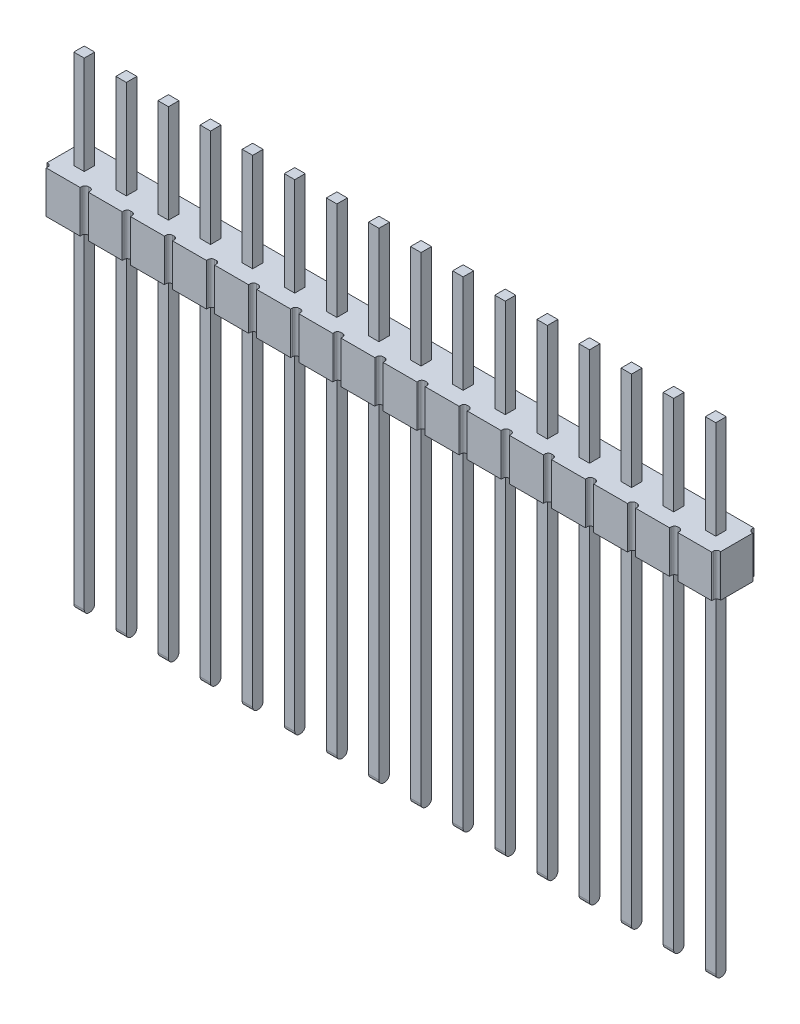
from build123d import *

# Parameters (mm, degrees)
BOSS_EXTRUDE1_DEPTH      = 1.285
BOSS_EXTRUDE1_DEPTH_BACK = 1.285
SKETCH1_W                = 41.12
SKETCH1_H                = 2.57
CUT_EXTRUDE2_DEPTH       = 21.759810332
LPATTERN2_COUNT          = 9
LPATTERN2_PITCH          = 2.57
LPATTERN2_COUNT_DIR2     = 9
LPATTERN2_PITCH_DIR2     = 2.57
MIRROR2_COPY_1_DEPTH     = 21.759810332
MIRROR2_COPY_2_DEPTH     = 21.759810332
MIRROR2_COPY_3_DEPTH     = 21.759810332
MIRROR2_COPY_4_DEPTH     = 21.759810332
MIRROR2_COPY_5_DEPTH     = 21.759810332
MIRROR2_COPY_6_DEPTH     = 21.759810332
MIRROR2_COPY_7_DEPTH     = 21.759810332
MIRROR2_COPY_8_DEPTH     = 21.759810332
MIRROR2_COPY_9_DEPTH     = 21.759810332
MIRROR2_COPY_10_DEPTH    = 21.759810332
MIRROR2_COPY_11_DEPTH    = 21.759810332
MIRROR2_COPY_12_DEPTH    = 21.759810332
MIRROR2_COPY_13_DEPTH    = 21.759810332
MIRROR2_COPY_14_DEPTH    = 21.759810332
MIRROR2_COPY_15_DEPTH    = 21.759810332
MIRROR2_COPY_16_DEPTH    = 21.759810332
MIRROR2_COPY_17_DEPTH    = 21.759810332
MIRROR2_COPY_18_DEPTH    = 21.759810332
MIRROR2_COPY_19_DEPTH    = 21.759810332
MIRROR2_COPY_20_DEPTH    = 21.759810332
MIRROR2_COPY_21_DEPTH    = 21.759810332
MIRROR2_COPY_22_DEPTH    = 21.759810332
MIRROR2_COPY_23_DEPTH    = 21.759810332
MIRROR2_COPY_24_DEPTH    = 21.759810332
MIRROR2_COPY_25_DEPTH    = 21.759810332
MIRROR2_COPY_26_DEPTH    = 21.759810332
MIRROR2_COPY_27_DEPTH    = 21.759810332
MIRROR2_COPY_28_DEPTH    = 21.759810332
MIRROR2_COPY_29_DEPTH    = 21.759810332
MIRROR2_COPY_30_DEPTH    = 21.759810332
MIRROR2_COPY_31_DEPTH    = 21.759810332
MIRROR2_COPY_32_DEPTH    = 21.759810332
MIRROR2_COPY_33_DEPTH    = 21.759810332
MIRROR2_COPY_34_DEPTH    = 21.759810332
MIRROR2_COPY_35_DEPTH    = 21.759810332
MIRROR2_COPY_36_DEPTH    = 21.759810332
MIRROR2_COPY_37_DEPTH    = 21.759810332
MIRROR2_COPY_38_DEPTH    = 21.759810332
MIRROR2_COPY_39_DEPTH    = 21.759810332
MIRROR2_COPY_40_DEPTH    = 21.759810332
MIRROR2_COPY_41_DEPTH    = 21.759810332
MIRROR2_COPY_42_DEPTH    = 21.759810332
MIRROR2_COPY_43_DEPTH    = 21.759810332
MIRROR2_COPY_44_DEPTH    = 21.759810332
MIRROR2_COPY_45_DEPTH    = 21.759810332
MIRROR2_COPY_46_DEPTH    = 21.759810332
MIRROR2_COPY_47_DEPTH    = 21.759810332
MIRROR2_COPY_48_DEPTH    = 21.759810332
MIRROR2_COPY_49_DEPTH    = 21.759810332
MIRROR2_COPY_50_DEPTH    = 21.759810332
MIRROR2_COPY_51_DEPTH    = 21.759810332
MIRROR2_COPY_52_DEPTH    = 21.759810332
MIRROR2_COPY_53_DEPTH    = 21.759810332
MIRROR2_COPY_54_DEPTH    = 21.759810332
MIRROR2_COPY_55_DEPTH    = 21.759810332
MIRROR2_COPY_56_DEPTH    = 21.759810332
MIRROR2_COPY_57_DEPTH    = 21.759810332
MIRROR2_COPY_58_DEPTH    = 21.759810332
MIRROR2_COPY_59_DEPTH    = 21.759810332
MIRROR2_COPY_60_DEPTH    = 21.759810332
MIRROR2_COPY_61_DEPTH    = 21.759810332
MIRROR2_COPY_62_DEPTH    = 21.759810332
MIRROR2_COPY_63_DEPTH    = 21.759810332
MIRROR2_COPY_64_DEPTH    = 21.759810332
MIRROR2_COPY_65_DEPTH    = 21.759810332
MIRROR2_COPY_66_DEPTH    = 21.759810332
MIRROR2_COPY_67_DEPTH    = 21.759810332
MIRROR2_COPY_68_DEPTH    = 21.759810332
MIRROR2_COPY_69_DEPTH    = 21.759810332
MIRROR2_COPY_70_DEPTH    = 21.759810332
MIRROR2_COPY_71_DEPTH    = 21.759810332
MIRROR2_COPY_72_DEPTH    = 21.759810332
MIRROR2_COPY_73_DEPTH    = 21.759810332
MIRROR2_COPY_74_DEPTH    = 21.759810332
MIRROR2_COPY_75_DEPTH    = 21.759810332
MIRROR2_COPY_76_DEPTH    = 21.759810332
MIRROR2_COPY_77_DEPTH    = 21.759810332
MIRROR2_COPY_78_DEPTH    = 21.759810332
MIRROR2_COPY_79_DEPTH    = 21.759810332
MIRROR2_COPY_80_DEPTH    = 21.759810332
MIRROR2_COPY_81_DEPTH    = 21.759810332
SKETCH5_W                = 0.64
SKETCH5_H                = 0.64
BOSS_EXTRUDE2_DEPTH      = 20.9
SKETCH4_W                = 0.64
SKETCH4_H                = 0.64
BOSS_EXTRUDE3_DEPTH      = 6
LPATTERN6_COUNT          = 9
LPATTERN6_PITCH          = 2.57
LPATTERN6_COUNT_DIR2     = 8
LPATTERN6_PITCH_DIR2     = 2.57
FILLET2_R                = 0.3


with BuildPart() as part:
    # Sketch1 → Boss-Extrude1 (new, two sides: drawn at the far end of the back side and taken through both)
    with BuildSketch(Plane.XY.offset(-BOSS_EXTRUDE1_DEPTH_BACK)):
        Rectangle(SKETCH1_W, SKETCH1_H)
    extrude(amount=BOSS_EXTRUDE1_DEPTH + BOSS_EXTRUDE1_DEPTH_BACK)

    # Sketch3 → Cut-Extrude2 (cut, through all)
    with BuildSketch(Plane(origin=(0, 1.285, 0), x_dir=(1, 0, 0), z_dir=(0, 1, 0))):
        with BuildLine():
            Line((-0.05, -0.985), (0.05, -0.985))
            ThreePointArc((0.05, -0.985), (0.191421356, -1.043578644), (0.25, -1.185))
            Line((0.25, -1.185), (0.25, -1.285))
            Line((0.25, -1.285), (-0.25, -1.285))
            Line((-0.25, -1.285), (-0.25, -1.185))
            ThreePointArc((-0.25, -1.185), (-0.191421356, -1.043578644), (-0.05, -0.985))
        make_face()
    cut_extrude2 = extrude(amount=-CUT_EXTRUDE2_DEPTH, mode=Mode.SUBTRACT)

    # LPattern2: Cut-Extrude2 9 × 9
    with Locations(*[Vector(-1, 0, 0) * (i * LPATTERN2_PITCH) + Vector(1, 0, 0) * (j * LPATTERN2_PITCH_DIR2) for i in range(LPATTERN2_COUNT) for j in range(LPATTERN2_COUNT_DIR2) if (i, j) != (0, 0)]):
        add(cut_extrude2, mode=Mode.SUBTRACT)

    # Mirror2 copy 1 sketch → Mirror2 copy 1 (cut, through all)
    with BuildSketch(Plane(origin=(2.57, 1.285, 0), x_dir=(1, 0, 0), z_dir=(0, 1, 0))):
        with BuildLine():
            Line((-0.05, 0.985), (0.05, 0.985))
            ThreePointArc((0.05, 0.985), (0.191421356, 1.043578644), (0.25, 1.185))
            Line((0.25, 1.185), (0.25, 1.285))
            Line((0.25, 1.285), (-0.25, 1.285))
            Line((-0.25, 1.285), (-0.25, 1.185))
            ThreePointArc((-0.25, 1.185), (-0.191421356, 1.043578644), (-0.05, 0.985))
        make_face()
    extrude(amount=-MIRROR2_COPY_1_DEPTH, mode=Mode.SUBTRACT)

    # Mirror2 copy 2 sketch → Mirror2 copy 2 (cut, through all)
    with BuildSketch(Plane(origin=(5.14, 1.285, 0), x_dir=(1, 0, 0), z_dir=(0, 1, 0))):
        with BuildLine():
            Line((-0.05, 0.985), (0.05, 0.985))
            ThreePointArc((0.05, 0.985), (0.191421356, 1.043578644), (0.25, 1.185))
            Line((0.25, 1.185), (0.25, 1.285))
            Line((0.25, 1.285), (-0.25, 1.285))
            Line((-0.25, 1.285), (-0.25, 1.185))
            ThreePointArc((-0.25, 1.185), (-0.191421356, 1.043578644), (-0.05, 0.985))
        make_face()
    extrude(amount=-MIRROR2_COPY_2_DEPTH, mode=Mode.SUBTRACT)

    # Mirror2 copy 3 sketch → Mirror2 copy 3 (cut, through all)
    with BuildSketch(Plane(origin=(7.71, 1.285, 0), x_dir=(1, 0, 0), z_dir=(0, 1, 0))):
        with BuildLine():
            Line((-0.05, 0.985), (0.05, 0.985))
            ThreePointArc((0.05, 0.985), (0.191421356, 1.043578644), (0.25, 1.185))
            Line((0.25, 1.185), (0.25, 1.285))
            Line((0.25, 1.285), (-0.25, 1.285))
            Line((-0.25, 1.285), (-0.25, 1.185))
            ThreePointArc((-0.25, 1.185), (-0.191421356, 1.043578644), (-0.05, 0.985))
        make_face()
    extrude(amount=-MIRROR2_COPY_3_DEPTH, mode=Mode.SUBTRACT)

    # Mirror2 copy 4 sketch → Mirror2 copy 4 (cut, through all)
    with BuildSketch(Plane(origin=(10.28, 1.285, 0), x_dir=(1, 0, 0), z_dir=(0, 1, 0))):
        with BuildLine():
            Line((-0.05, 0.985), (0.05, 0.985))
            ThreePointArc((0.05, 0.985), (0.191421356, 1.043578644), (0.25, 1.185))
            Line((0.25, 1.185), (0.25, 1.285))
            Line((0.25, 1.285), (-0.25, 1.285))
            Line((-0.25, 1.285), (-0.25, 1.185))
            ThreePointArc((-0.25, 1.185), (-0.191421356, 1.043578644), (-0.05, 0.985))
        make_face()
    extrude(amount=-MIRROR2_COPY_4_DEPTH, mode=Mode.SUBTRACT)

    # Mirror2 copy 5 sketch → Mirror2 copy 5 (cut, through all)
    with BuildSketch(Plane(origin=(12.85, 1.285, 0), x_dir=(1, 0, 0), z_dir=(0, 1, 0))):
        with BuildLine():
            Line((-0.05, 0.985), (0.05, 0.985))
            ThreePointArc((0.05, 0.985), (0.191421356, 1.043578644), (0.25, 1.185))
            Line((0.25, 1.185), (0.25, 1.285))
            Line((0.25, 1.285), (-0.25, 1.285))
            Line((-0.25, 1.285), (-0.25, 1.185))
            ThreePointArc((-0.25, 1.185), (-0.191421356, 1.043578644), (-0.05, 0.985))
        make_face()
    extrude(amount=-MIRROR2_COPY_5_DEPTH, mode=Mode.SUBTRACT)

    # Mirror2 copy 6 sketch → Mirror2 copy 6 (cut, through all)
    with BuildSketch(Plane(origin=(15.42, 1.285, 0), x_dir=(1, 0, 0), z_dir=(0, 1, 0))):
        with BuildLine():
            Line((-0.05, 0.985), (0.05, 0.985))
            ThreePointArc((0.05, 0.985), (0.191421356, 1.043578644), (0.25, 1.185))
            Line((0.25, 1.185), (0.25, 1.285))
            Line((0.25, 1.285), (-0.25, 1.285))
            Line((-0.25, 1.285), (-0.25, 1.185))
            ThreePointArc((-0.25, 1.185), (-0.191421356, 1.043578644), (-0.05, 0.985))
        make_face()
    extrude(amount=-MIRROR2_COPY_6_DEPTH, mode=Mode.SUBTRACT)

    # Mirror2 copy 7 sketch → Mirror2 copy 7 (cut, through all)
    with BuildSketch(Plane(origin=(17.99, 1.285, 0), x_dir=(1, 0, 0), z_dir=(0, 1, 0))):
        with BuildLine():
            Line((-0.05, 0.985), (0.05, 0.985))
            ThreePointArc((0.05, 0.985), (0.191421356, 1.043578644), (0.25, 1.185))
            Line((0.25, 1.185), (0.25, 1.285))
            Line((0.25, 1.285), (-0.25, 1.285))
            Line((-0.25, 1.285), (-0.25, 1.185))
            ThreePointArc((-0.25, 1.185), (-0.191421356, 1.043578644), (-0.05, 0.985))
        make_face()
    extrude(amount=-MIRROR2_COPY_7_DEPTH, mode=Mode.SUBTRACT)

    # Mirror2 copy 8 sketch → Mirror2 copy 8 (cut, through all)
    with BuildSketch(Plane(origin=(20.56, 1.285, 0), x_dir=(1, 0, 0), z_dir=(0, 1, 0))):
        with BuildLine():
            Line((-0.05, 0.985), (0.05, 0.985))
            ThreePointArc((0.05, 0.985), (0.191421356, 1.043578644), (0.25, 1.185))
            Line((0.25, 1.185), (0.25, 1.285))
            Line((0.25, 1.285), (-0.25, 1.285))
            Line((-0.25, 1.285), (-0.25, 1.185))
            ThreePointArc((-0.25, 1.185), (-0.191421356, 1.043578644), (-0.05, 0.985))
        make_face()
    extrude(amount=-MIRROR2_COPY_8_DEPTH, mode=Mode.SUBTRACT)

    # Mirror2 copy 9 sketch → Mirror2 copy 9 (cut, through all)
    with BuildSketch(Plane(origin=(-2.57, 1.285, 0), x_dir=(1, 0, 0), z_dir=(0, 1, 0))):
        with BuildLine():
            Line((-0.05, 0.985), (0.05, 0.985))
            ThreePointArc((0.05, 0.985), (0.191421356, 1.043578644), (0.25, 1.185))
            Line((0.25, 1.185), (0.25, 1.285))
            Line((0.25, 1.285), (-0.25, 1.285))
            Line((-0.25, 1.285), (-0.25, 1.185))
            ThreePointArc((-0.25, 1.185), (-0.191421356, 1.043578644), (-0.05, 0.985))
        make_face()
    extrude(amount=-MIRROR2_COPY_9_DEPTH, mode=Mode.SUBTRACT)

    # Mirror2 copy 10 sketch → Mirror2 copy 10 (cut, through all)
    with BuildSketch(Plane(origin=(0, 1.285, 0), x_dir=(1, 0, 0), z_dir=(0, 1, 0))):
        with BuildLine():
            Line((-0.05, 0.985), (0.05, 0.985))
            ThreePointArc((0.05, 0.985), (0.191421356, 1.043578644), (0.25, 1.185))
            Line((0.25, 1.185), (0.25, 1.285))
            Line((0.25, 1.285), (-0.25, 1.285))
            Line((-0.25, 1.285), (-0.25, 1.185))
            ThreePointArc((-0.25, 1.185), (-0.191421356, 1.043578644), (-0.05, 0.985))
        make_face()
    extrude(amount=-MIRROR2_COPY_10_DEPTH, mode=Mode.SUBTRACT)

    # Mirror2 copy 11 sketch → Mirror2 copy 11 (cut, through all)
    with BuildSketch(Plane(origin=(2.57, 1.285, 0), x_dir=(1, 0, 0), z_dir=(0, 1, 0))):
        with BuildLine():
            Line((-0.05, 0.985), (0.05, 0.985))
            ThreePointArc((0.05, 0.985), (0.191421356, 1.043578644), (0.25, 1.185))
            Line((0.25, 1.185), (0.25, 1.285))
            Line((0.25, 1.285), (-0.25, 1.285))
            Line((-0.25, 1.285), (-0.25, 1.185))
            ThreePointArc((-0.25, 1.185), (-0.191421356, 1.043578644), (-0.05, 0.985))
        make_face()
    extrude(amount=-MIRROR2_COPY_11_DEPTH, mode=Mode.SUBTRACT)

    # Mirror2 copy 12 sketch → Mirror2 copy 12 (cut, through all)
    with BuildSketch(Plane(origin=(5.14, 1.285, 0), x_dir=(1, 0, 0), z_dir=(0, 1, 0))):
        with BuildLine():
            Line((-0.05, 0.985), (0.05, 0.985))
            ThreePointArc((0.05, 0.985), (0.191421356, 1.043578644), (0.25, 1.185))
            Line((0.25, 1.185), (0.25, 1.285))
            Line((0.25, 1.285), (-0.25, 1.285))
            Line((-0.25, 1.285), (-0.25, 1.185))
            ThreePointArc((-0.25, 1.185), (-0.191421356, 1.043578644), (-0.05, 0.985))
        make_face()
    extrude(amount=-MIRROR2_COPY_12_DEPTH, mode=Mode.SUBTRACT)

    # Mirror2 copy 13 sketch → Mirror2 copy 13 (cut, through all)
    with BuildSketch(Plane(origin=(7.71, 1.285, 0), x_dir=(1, 0, 0), z_dir=(0, 1, 0))):
        with BuildLine():
            Line((-0.05, 0.985), (0.05, 0.985))
            ThreePointArc((0.05, 0.985), (0.191421356, 1.043578644), (0.25, 1.185))
            Line((0.25, 1.185), (0.25, 1.285))
            Line((0.25, 1.285), (-0.25, 1.285))
            Line((-0.25, 1.285), (-0.25, 1.185))
            ThreePointArc((-0.25, 1.185), (-0.191421356, 1.043578644), (-0.05, 0.985))
        make_face()
    extrude(amount=-MIRROR2_COPY_13_DEPTH, mode=Mode.SUBTRACT)

    # Mirror2 copy 14 sketch → Mirror2 copy 14 (cut, through all)
    with BuildSketch(Plane(origin=(10.28, 1.285, 0), x_dir=(1, 0, 0), z_dir=(0, 1, 0))):
        with BuildLine():
            Line((-0.05, 0.985), (0.05, 0.985))
            ThreePointArc((0.05, 0.985), (0.191421356, 1.043578644), (0.25, 1.185))
            Line((0.25, 1.185), (0.25, 1.285))
            Line((0.25, 1.285), (-0.25, 1.285))
            Line((-0.25, 1.285), (-0.25, 1.185))
            ThreePointArc((-0.25, 1.185), (-0.191421356, 1.043578644), (-0.05, 0.985))
        make_face()
    extrude(amount=-MIRROR2_COPY_14_DEPTH, mode=Mode.SUBTRACT)

    # Mirror2 copy 15 sketch → Mirror2 copy 15 (cut, through all)
    with BuildSketch(Plane(origin=(12.85, 1.285, 0), x_dir=(1, 0, 0), z_dir=(0, 1, 0))):
        with BuildLine():
            Line((-0.05, 0.985), (0.05, 0.985))
            ThreePointArc((0.05, 0.985), (0.191421356, 1.043578644), (0.25, 1.185))
            Line((0.25, 1.185), (0.25, 1.285))
            Line((0.25, 1.285), (-0.25, 1.285))
            Line((-0.25, 1.285), (-0.25, 1.185))
            ThreePointArc((-0.25, 1.185), (-0.191421356, 1.043578644), (-0.05, 0.985))
        make_face()
    extrude(amount=-MIRROR2_COPY_15_DEPTH, mode=Mode.SUBTRACT)

    # Mirror2 copy 16 sketch → Mirror2 copy 16 (cut, through all)
    with BuildSketch(Plane(origin=(15.42, 1.285, 0), x_dir=(1, 0, 0), z_dir=(0, 1, 0))):
        with BuildLine():
            Line((-0.05, 0.985), (0.05, 0.985))
            ThreePointArc((0.05, 0.985), (0.191421356, 1.043578644), (0.25, 1.185))
            Line((0.25, 1.185), (0.25, 1.285))
            Line((0.25, 1.285), (-0.25, 1.285))
            Line((-0.25, 1.285), (-0.25, 1.185))
            ThreePointArc((-0.25, 1.185), (-0.191421356, 1.043578644), (-0.05, 0.985))
        make_face()
    extrude(amount=-MIRROR2_COPY_16_DEPTH, mode=Mode.SUBTRACT)

    # Mirror2 copy 17 sketch → Mirror2 copy 17 (cut, through all)
    with BuildSketch(Plane(origin=(17.99, 1.285, 0), x_dir=(1, 0, 0), z_dir=(0, 1, 0))):
        with BuildLine():
            Line((-0.05, 0.985), (0.05, 0.985))
            ThreePointArc((0.05, 0.985), (0.191421356, 1.043578644), (0.25, 1.185))
            Line((0.25, 1.185), (0.25, 1.285))
            Line((0.25, 1.285), (-0.25, 1.285))
            Line((-0.25, 1.285), (-0.25, 1.185))
            ThreePointArc((-0.25, 1.185), (-0.191421356, 1.043578644), (-0.05, 0.985))
        make_face()
    extrude(amount=-MIRROR2_COPY_17_DEPTH, mode=Mode.SUBTRACT)

    # Mirror2 copy 18 sketch → Mirror2 copy 18 (cut, through all)
    with BuildSketch(Plane(origin=(-5.14, 1.285, 0), x_dir=(1, 0, 0), z_dir=(0, 1, 0))):
        with BuildLine():
            Line((-0.05, 0.985), (0.05, 0.985))
            ThreePointArc((0.05, 0.985), (0.191421356, 1.043578644), (0.25, 1.185))
            Line((0.25, 1.185), (0.25, 1.285))
            Line((0.25, 1.285), (-0.25, 1.285))
            Line((-0.25, 1.285), (-0.25, 1.185))
            ThreePointArc((-0.25, 1.185), (-0.191421356, 1.043578644), (-0.05, 0.985))
        make_face()
    extrude(amount=-MIRROR2_COPY_18_DEPTH, mode=Mode.SUBTRACT)

    # Mirror2 copy 19 sketch → Mirror2 copy 19 (cut, through all)
    with BuildSketch(Plane(origin=(-2.57, 1.285, 0), x_dir=(1, 0, 0), z_dir=(0, 1, 0))):
        with BuildLine():
            Line((-0.05, 0.985), (0.05, 0.985))
            ThreePointArc((0.05, 0.985), (0.191421356, 1.043578644), (0.25, 1.185))
            Line((0.25, 1.185), (0.25, 1.285))
            Line((0.25, 1.285), (-0.25, 1.285))
            Line((-0.25, 1.285), (-0.25, 1.185))
            ThreePointArc((-0.25, 1.185), (-0.191421356, 1.043578644), (-0.05, 0.985))
        make_face()
    extrude(amount=-MIRROR2_COPY_19_DEPTH, mode=Mode.SUBTRACT)

    # Mirror2 copy 20 sketch → Mirror2 copy 20 (cut, through all)
    with BuildSketch(Plane(origin=(0, 1.285, 0), x_dir=(1, 0, 0), z_dir=(0, 1, 0))):
        with BuildLine():
            Line((-0.05, 0.985), (0.05, 0.985))
            ThreePointArc((0.05, 0.985), (0.191421356, 1.043578644), (0.25, 1.185))
            Line((0.25, 1.185), (0.25, 1.285))
            Line((0.25, 1.285), (-0.25, 1.285))
            Line((-0.25, 1.285), (-0.25, 1.185))
            ThreePointArc((-0.25, 1.185), (-0.191421356, 1.043578644), (-0.05, 0.985))
        make_face()
    extrude(amount=-MIRROR2_COPY_20_DEPTH, mode=Mode.SUBTRACT)

    # Mirror2 copy 21 sketch → Mirror2 copy 21 (cut, through all)
    with BuildSketch(Plane(origin=(2.57, 1.285, 0), x_dir=(1, 0, 0), z_dir=(0, 1, 0))):
        with BuildLine():
            Line((-0.05, 0.985), (0.05, 0.985))
            ThreePointArc((0.05, 0.985), (0.191421356, 1.043578644), (0.25, 1.185))
            Line((0.25, 1.185), (0.25, 1.285))
            Line((0.25, 1.285), (-0.25, 1.285))
            Line((-0.25, 1.285), (-0.25, 1.185))
            ThreePointArc((-0.25, 1.185), (-0.191421356, 1.043578644), (-0.05, 0.985))
        make_face()
    extrude(amount=-MIRROR2_COPY_21_DEPTH, mode=Mode.SUBTRACT)

    # Mirror2 copy 22 sketch → Mirror2 copy 22 (cut, through all)
    with BuildSketch(Plane(origin=(5.14, 1.285, 0), x_dir=(1, 0, 0), z_dir=(0, 1, 0))):
        with BuildLine():
            Line((-0.05, 0.985), (0.05, 0.985))
            ThreePointArc((0.05, 0.985), (0.191421356, 1.043578644), (0.25, 1.185))
            Line((0.25, 1.185), (0.25, 1.285))
            Line((0.25, 1.285), (-0.25, 1.285))
            Line((-0.25, 1.285), (-0.25, 1.185))
            ThreePointArc((-0.25, 1.185), (-0.191421356, 1.043578644), (-0.05, 0.985))
        make_face()
    extrude(amount=-MIRROR2_COPY_22_DEPTH, mode=Mode.SUBTRACT)

    # Mirror2 copy 23 sketch → Mirror2 copy 23 (cut, through all)
    with BuildSketch(Plane(origin=(7.71, 1.285, 0), x_dir=(1, 0, 0), z_dir=(0, 1, 0))):
        with BuildLine():
            Line((-0.05, 0.985), (0.05, 0.985))
            ThreePointArc((0.05, 0.985), (0.191421356, 1.043578644), (0.25, 1.185))
            Line((0.25, 1.185), (0.25, 1.285))
            Line((0.25, 1.285), (-0.25, 1.285))
            Line((-0.25, 1.285), (-0.25, 1.185))
            ThreePointArc((-0.25, 1.185), (-0.191421356, 1.043578644), (-0.05, 0.985))
        make_face()
    extrude(amount=-MIRROR2_COPY_23_DEPTH, mode=Mode.SUBTRACT)

    # Mirror2 copy 24 sketch → Mirror2 copy 24 (cut, through all)
    with BuildSketch(Plane(origin=(10.28, 1.285, 0), x_dir=(1, 0, 0), z_dir=(0, 1, 0))):
        with BuildLine():
            Line((-0.05, 0.985), (0.05, 0.985))
            ThreePointArc((0.05, 0.985), (0.191421356, 1.043578644), (0.25, 1.185))
            Line((0.25, 1.185), (0.25, 1.285))
            Line((0.25, 1.285), (-0.25, 1.285))
            Line((-0.25, 1.285), (-0.25, 1.185))
            ThreePointArc((-0.25, 1.185), (-0.191421356, 1.043578644), (-0.05, 0.985))
        make_face()
    extrude(amount=-MIRROR2_COPY_24_DEPTH, mode=Mode.SUBTRACT)

    # Mirror2 copy 25 sketch → Mirror2 copy 25 (cut, through all)
    with BuildSketch(Plane(origin=(12.85, 1.285, 0), x_dir=(1, 0, 0), z_dir=(0, 1, 0))):
        with BuildLine():
            Line((-0.05, 0.985), (0.05, 0.985))
            ThreePointArc((0.05, 0.985), (0.191421356, 1.043578644), (0.25, 1.185))
            Line((0.25, 1.185), (0.25, 1.285))
            Line((0.25, 1.285), (-0.25, 1.285))
            Line((-0.25, 1.285), (-0.25, 1.185))
            ThreePointArc((-0.25, 1.185), (-0.191421356, 1.043578644), (-0.05, 0.985))
        make_face()
    extrude(amount=-MIRROR2_COPY_25_DEPTH, mode=Mode.SUBTRACT)

    # Mirror2 copy 26 sketch → Mirror2 copy 26 (cut, through all)
    with BuildSketch(Plane(origin=(15.42, 1.285, 0), x_dir=(1, 0, 0), z_dir=(0, 1, 0))):
        with BuildLine():
            Line((-0.05, 0.985), (0.05, 0.985))
            ThreePointArc((0.05, 0.985), (0.191421356, 1.043578644), (0.25, 1.185))
            Line((0.25, 1.185), (0.25, 1.285))
            Line((0.25, 1.285), (-0.25, 1.285))
            Line((-0.25, 1.285), (-0.25, 1.185))
            ThreePointArc((-0.25, 1.185), (-0.191421356, 1.043578644), (-0.05, 0.985))
        make_face()
    extrude(amount=-MIRROR2_COPY_26_DEPTH, mode=Mode.SUBTRACT)

    # Mirror2 copy 27 sketch → Mirror2 copy 27 (cut, through all)
    with BuildSketch(Plane(origin=(-7.71, 1.285, 0), x_dir=(1, 0, 0), z_dir=(0, 1, 0))):
        with BuildLine():
            Line((-0.05, 0.985), (0.05, 0.985))
            ThreePointArc((0.05, 0.985), (0.191421356, 1.043578644), (0.25, 1.185))
            Line((0.25, 1.185), (0.25, 1.285))
            Line((0.25, 1.285), (-0.25, 1.285))
            Line((-0.25, 1.285), (-0.25, 1.185))
            ThreePointArc((-0.25, 1.185), (-0.191421356, 1.043578644), (-0.05, 0.985))
        make_face()
    extrude(amount=-MIRROR2_COPY_27_DEPTH, mode=Mode.SUBTRACT)

    # Mirror2 copy 28 sketch → Mirror2 copy 28 (cut, through all)
    with BuildSketch(Plane(origin=(-5.14, 1.285, 0), x_dir=(1, 0, 0), z_dir=(0, 1, 0))):
        with BuildLine():
            Line((-0.05, 0.985), (0.05, 0.985))
            ThreePointArc((0.05, 0.985), (0.191421356, 1.043578644), (0.25, 1.185))
            Line((0.25, 1.185), (0.25, 1.285))
            Line((0.25, 1.285), (-0.25, 1.285))
            Line((-0.25, 1.285), (-0.25, 1.185))
            ThreePointArc((-0.25, 1.185), (-0.191421356, 1.043578644), (-0.05, 0.985))
        make_face()
    extrude(amount=-MIRROR2_COPY_28_DEPTH, mode=Mode.SUBTRACT)

    # Mirror2 copy 29 sketch → Mirror2 copy 29 (cut, through all)
    with BuildSketch(Plane(origin=(-2.57, 1.285, 0), x_dir=(1, 0, 0), z_dir=(0, 1, 0))):
        with BuildLine():
            Line((-0.05, 0.985), (0.05, 0.985))
            ThreePointArc((0.05, 0.985), (0.191421356, 1.043578644), (0.25, 1.185))
            Line((0.25, 1.185), (0.25, 1.285))
            Line((0.25, 1.285), (-0.25, 1.285))
            Line((-0.25, 1.285), (-0.25, 1.185))
            ThreePointArc((-0.25, 1.185), (-0.191421356, 1.043578644), (-0.05, 0.985))
        make_face()
    extrude(amount=-MIRROR2_COPY_29_DEPTH, mode=Mode.SUBTRACT)

    # Mirror2 copy 30 sketch → Mirror2 copy 30 (cut, through all)
    with BuildSketch(Plane(origin=(0, 1.285, 0), x_dir=(1, 0, 0), z_dir=(0, 1, 0))):
        with BuildLine():
            Line((-0.05, 0.985), (0.05, 0.985))
            ThreePointArc((0.05, 0.985), (0.191421356, 1.043578644), (0.25, 1.185))
            Line((0.25, 1.185), (0.25, 1.285))
            Line((0.25, 1.285), (-0.25, 1.285))
            Line((-0.25, 1.285), (-0.25, 1.185))
            ThreePointArc((-0.25, 1.185), (-0.191421356, 1.043578644), (-0.05, 0.985))
        make_face()
    extrude(amount=-MIRROR2_COPY_30_DEPTH, mode=Mode.SUBTRACT)

    # Mirror2 copy 31 sketch → Mirror2 copy 31 (cut, through all)
    with BuildSketch(Plane(origin=(2.57, 1.285, 0), x_dir=(1, 0, 0), z_dir=(0, 1, 0))):
        with BuildLine():
            Line((-0.05, 0.985), (0.05, 0.985))
            ThreePointArc((0.05, 0.985), (0.191421356, 1.043578644), (0.25, 1.185))
            Line((0.25, 1.185), (0.25, 1.285))
            Line((0.25, 1.285), (-0.25, 1.285))
            Line((-0.25, 1.285), (-0.25, 1.185))
            ThreePointArc((-0.25, 1.185), (-0.191421356, 1.043578644), (-0.05, 0.985))
        make_face()
    extrude(amount=-MIRROR2_COPY_31_DEPTH, mode=Mode.SUBTRACT)

    # Mirror2 copy 32 sketch → Mirror2 copy 32 (cut, through all)
    with BuildSketch(Plane(origin=(5.14, 1.285, 0), x_dir=(1, 0, 0), z_dir=(0, 1, 0))):
        with BuildLine():
            Line((-0.05, 0.985), (0.05, 0.985))
            ThreePointArc((0.05, 0.985), (0.191421356, 1.043578644), (0.25, 1.185))
            Line((0.25, 1.185), (0.25, 1.285))
            Line((0.25, 1.285), (-0.25, 1.285))
            Line((-0.25, 1.285), (-0.25, 1.185))
            ThreePointArc((-0.25, 1.185), (-0.191421356, 1.043578644), (-0.05, 0.985))
        make_face()
    extrude(amount=-MIRROR2_COPY_32_DEPTH, mode=Mode.SUBTRACT)

    # Mirror2 copy 33 sketch → Mirror2 copy 33 (cut, through all)
    with BuildSketch(Plane(origin=(7.71, 1.285, 0), x_dir=(1, 0, 0), z_dir=(0, 1, 0))):
        with BuildLine():
            Line((-0.05, 0.985), (0.05, 0.985))
            ThreePointArc((0.05, 0.985), (0.191421356, 1.043578644), (0.25, 1.185))
            Line((0.25, 1.185), (0.25, 1.285))
            Line((0.25, 1.285), (-0.25, 1.285))
            Line((-0.25, 1.285), (-0.25, 1.185))
            ThreePointArc((-0.25, 1.185), (-0.191421356, 1.043578644), (-0.05, 0.985))
        make_face()
    extrude(amount=-MIRROR2_COPY_33_DEPTH, mode=Mode.SUBTRACT)

    # Mirror2 copy 34 sketch → Mirror2 copy 34 (cut, through all)
    with BuildSketch(Plane(origin=(10.28, 1.285, 0), x_dir=(1, 0, 0), z_dir=(0, 1, 0))):
        with BuildLine():
            Line((-0.05, 0.985), (0.05, 0.985))
            ThreePointArc((0.05, 0.985), (0.191421356, 1.043578644), (0.25, 1.185))
            Line((0.25, 1.185), (0.25, 1.285))
            Line((0.25, 1.285), (-0.25, 1.285))
            Line((-0.25, 1.285), (-0.25, 1.185))
            ThreePointArc((-0.25, 1.185), (-0.191421356, 1.043578644), (-0.05, 0.985))
        make_face()
    extrude(amount=-MIRROR2_COPY_34_DEPTH, mode=Mode.SUBTRACT)

    # Mirror2 copy 35 sketch → Mirror2 copy 35 (cut, through all)
    with BuildSketch(Plane(origin=(12.85, 1.285, 0), x_dir=(1, 0, 0), z_dir=(0, 1, 0))):
        with BuildLine():
            Line((-0.05, 0.985), (0.05, 0.985))
            ThreePointArc((0.05, 0.985), (0.191421356, 1.043578644), (0.25, 1.185))
            Line((0.25, 1.185), (0.25, 1.285))
            Line((0.25, 1.285), (-0.25, 1.285))
            Line((-0.25, 1.285), (-0.25, 1.185))
            ThreePointArc((-0.25, 1.185), (-0.191421356, 1.043578644), (-0.05, 0.985))
        make_face()
    extrude(amount=-MIRROR2_COPY_35_DEPTH, mode=Mode.SUBTRACT)

    # Mirror2 copy 36 sketch → Mirror2 copy 36 (cut, through all)
    with BuildSketch(Plane(origin=(-10.28, 1.285, 0), x_dir=(1, 0, 0), z_dir=(0, 1, 0))):
        with BuildLine():
            Line((-0.05, 0.985), (0.05, 0.985))
            ThreePointArc((0.05, 0.985), (0.191421356, 1.043578644), (0.25, 1.185))
            Line((0.25, 1.185), (0.25, 1.285))
            Line((0.25, 1.285), (-0.25, 1.285))
            Line((-0.25, 1.285), (-0.25, 1.185))
            ThreePointArc((-0.25, 1.185), (-0.191421356, 1.043578644), (-0.05, 0.985))
        make_face()
    extrude(amount=-MIRROR2_COPY_36_DEPTH, mode=Mode.SUBTRACT)

    # Mirror2 copy 37 sketch → Mirror2 copy 37 (cut, through all)
    with BuildSketch(Plane(origin=(-7.71, 1.285, 0), x_dir=(1, 0, 0), z_dir=(0, 1, 0))):
        with BuildLine():
            Line((-0.05, 0.985), (0.05, 0.985))
            ThreePointArc((0.05, 0.985), (0.191421356, 1.043578644), (0.25, 1.185))
            Line((0.25, 1.185), (0.25, 1.285))
            Line((0.25, 1.285), (-0.25, 1.285))
            Line((-0.25, 1.285), (-0.25, 1.185))
            ThreePointArc((-0.25, 1.185), (-0.191421356, 1.043578644), (-0.05, 0.985))
        make_face()
    extrude(amount=-MIRROR2_COPY_37_DEPTH, mode=Mode.SUBTRACT)

    # Mirror2 copy 38 sketch → Mirror2 copy 38 (cut, through all)
    with BuildSketch(Plane(origin=(-5.14, 1.285, 0), x_dir=(1, 0, 0), z_dir=(0, 1, 0))):
        with BuildLine():
            Line((-0.05, 0.985), (0.05, 0.985))
            ThreePointArc((0.05, 0.985), (0.191421356, 1.043578644), (0.25, 1.185))
            Line((0.25, 1.185), (0.25, 1.285))
            Line((0.25, 1.285), (-0.25, 1.285))
            Line((-0.25, 1.285), (-0.25, 1.185))
            ThreePointArc((-0.25, 1.185), (-0.191421356, 1.043578644), (-0.05, 0.985))
        make_face()
    extrude(amount=-MIRROR2_COPY_38_DEPTH, mode=Mode.SUBTRACT)

    # Mirror2 copy 39 sketch → Mirror2 copy 39 (cut, through all)
    with BuildSketch(Plane(origin=(-2.57, 1.285, 0), x_dir=(1, 0, 0), z_dir=(0, 1, 0))):
        with BuildLine():
            Line((-0.05, 0.985), (0.05, 0.985))
            ThreePointArc((0.05, 0.985), (0.191421356, 1.043578644), (0.25, 1.185))
            Line((0.25, 1.185), (0.25, 1.285))
            Line((0.25, 1.285), (-0.25, 1.285))
            Line((-0.25, 1.285), (-0.25, 1.185))
            ThreePointArc((-0.25, 1.185), (-0.191421356, 1.043578644), (-0.05, 0.985))
        make_face()
    extrude(amount=-MIRROR2_COPY_39_DEPTH, mode=Mode.SUBTRACT)

    # Mirror2 copy 40 sketch → Mirror2 copy 40 (cut, through all)
    with BuildSketch(Plane(origin=(0, 1.285, 0), x_dir=(1, 0, 0), z_dir=(0, 1, 0))):
        with BuildLine():
            Line((-0.05, 0.985), (0.05, 0.985))
            ThreePointArc((0.05, 0.985), (0.191421356, 1.043578644), (0.25, 1.185))
            Line((0.25, 1.185), (0.25, 1.285))
            Line((0.25, 1.285), (-0.25, 1.285))
            Line((-0.25, 1.285), (-0.25, 1.185))
            ThreePointArc((-0.25, 1.185), (-0.191421356, 1.043578644), (-0.05, 0.985))
        make_face()
    extrude(amount=-MIRROR2_COPY_40_DEPTH, mode=Mode.SUBTRACT)

    # Mirror2 copy 41 sketch → Mirror2 copy 41 (cut, through all)
    with BuildSketch(Plane(origin=(2.57, 1.285, 0), x_dir=(1, 0, 0), z_dir=(0, 1, 0))):
        with BuildLine():
            Line((-0.05, 0.985), (0.05, 0.985))
            ThreePointArc((0.05, 0.985), (0.191421356, 1.043578644), (0.25, 1.185))
            Line((0.25, 1.185), (0.25, 1.285))
            Line((0.25, 1.285), (-0.25, 1.285))
            Line((-0.25, 1.285), (-0.25, 1.185))
            ThreePointArc((-0.25, 1.185), (-0.191421356, 1.043578644), (-0.05, 0.985))
        make_face()
    extrude(amount=-MIRROR2_COPY_41_DEPTH, mode=Mode.SUBTRACT)

    # Mirror2 copy 42 sketch → Mirror2 copy 42 (cut, through all)
    with BuildSketch(Plane(origin=(5.14, 1.285, 0), x_dir=(1, 0, 0), z_dir=(0, 1, 0))):
        with BuildLine():
            Line((-0.05, 0.985), (0.05, 0.985))
            ThreePointArc((0.05, 0.985), (0.191421356, 1.043578644), (0.25, 1.185))
            Line((0.25, 1.185), (0.25, 1.285))
            Line((0.25, 1.285), (-0.25, 1.285))
            Line((-0.25, 1.285), (-0.25, 1.185))
            ThreePointArc((-0.25, 1.185), (-0.191421356, 1.043578644), (-0.05, 0.985))
        make_face()
    extrude(amount=-MIRROR2_COPY_42_DEPTH, mode=Mode.SUBTRACT)

    # Mirror2 copy 43 sketch → Mirror2 copy 43 (cut, through all)
    with BuildSketch(Plane(origin=(7.71, 1.285, 0), x_dir=(1, 0, 0), z_dir=(0, 1, 0))):
        with BuildLine():
            Line((-0.05, 0.985), (0.05, 0.985))
            ThreePointArc((0.05, 0.985), (0.191421356, 1.043578644), (0.25, 1.185))
            Line((0.25, 1.185), (0.25, 1.285))
            Line((0.25, 1.285), (-0.25, 1.285))
            Line((-0.25, 1.285), (-0.25, 1.185))
            ThreePointArc((-0.25, 1.185), (-0.191421356, 1.043578644), (-0.05, 0.985))
        make_face()
    extrude(amount=-MIRROR2_COPY_43_DEPTH, mode=Mode.SUBTRACT)

    # Mirror2 copy 44 sketch → Mirror2 copy 44 (cut, through all)
    with BuildSketch(Plane(origin=(10.28, 1.285, 0), x_dir=(1, 0, 0), z_dir=(0, 1, 0))):
        with BuildLine():
            Line((-0.05, 0.985), (0.05, 0.985))
            ThreePointArc((0.05, 0.985), (0.191421356, 1.043578644), (0.25, 1.185))
            Line((0.25, 1.185), (0.25, 1.285))
            Line((0.25, 1.285), (-0.25, 1.285))
            Line((-0.25, 1.285), (-0.25, 1.185))
            ThreePointArc((-0.25, 1.185), (-0.191421356, 1.043578644), (-0.05, 0.985))
        make_face()
    extrude(amount=-MIRROR2_COPY_44_DEPTH, mode=Mode.SUBTRACT)

    # Mirror2 copy 45 sketch → Mirror2 copy 45 (cut, through all)
    with BuildSketch(Plane(origin=(-12.85, 1.285, 0), x_dir=(1, 0, 0), z_dir=(0, 1, 0))):
        with BuildLine():
            Line((-0.05, 0.985), (0.05, 0.985))
            ThreePointArc((0.05, 0.985), (0.191421356, 1.043578644), (0.25, 1.185))
            Line((0.25, 1.185), (0.25, 1.285))
            Line((0.25, 1.285), (-0.25, 1.285))
            Line((-0.25, 1.285), (-0.25, 1.185))
            ThreePointArc((-0.25, 1.185), (-0.191421356, 1.043578644), (-0.05, 0.985))
        make_face()
    extrude(amount=-MIRROR2_COPY_45_DEPTH, mode=Mode.SUBTRACT)

    # Mirror2 copy 46 sketch → Mirror2 copy 46 (cut, through all)
    with BuildSketch(Plane(origin=(-10.28, 1.285, 0), x_dir=(1, 0, 0), z_dir=(0, 1, 0))):
        with BuildLine():
            Line((-0.05, 0.985), (0.05, 0.985))
            ThreePointArc((0.05, 0.985), (0.191421356, 1.043578644), (0.25, 1.185))
            Line((0.25, 1.185), (0.25, 1.285))
            Line((0.25, 1.285), (-0.25, 1.285))
            Line((-0.25, 1.285), (-0.25, 1.185))
            ThreePointArc((-0.25, 1.185), (-0.191421356, 1.043578644), (-0.05, 0.985))
        make_face()
    extrude(amount=-MIRROR2_COPY_46_DEPTH, mode=Mode.SUBTRACT)

    # Mirror2 copy 47 sketch → Mirror2 copy 47 (cut, through all)
    with BuildSketch(Plane(origin=(-7.71, 1.285, 0), x_dir=(1, 0, 0), z_dir=(0, 1, 0))):
        with BuildLine():
            Line((-0.05, 0.985), (0.05, 0.985))
            ThreePointArc((0.05, 0.985), (0.191421356, 1.043578644), (0.25, 1.185))
            Line((0.25, 1.185), (0.25, 1.285))
            Line((0.25, 1.285), (-0.25, 1.285))
            Line((-0.25, 1.285), (-0.25, 1.185))
            ThreePointArc((-0.25, 1.185), (-0.191421356, 1.043578644), (-0.05, 0.985))
        make_face()
    extrude(amount=-MIRROR2_COPY_47_DEPTH, mode=Mode.SUBTRACT)

    # Mirror2 copy 48 sketch → Mirror2 copy 48 (cut, through all)
    with BuildSketch(Plane(origin=(-5.14, 1.285, 0), x_dir=(1, 0, 0), z_dir=(0, 1, 0))):
        with BuildLine():
            Line((-0.05, 0.985), (0.05, 0.985))
            ThreePointArc((0.05, 0.985), (0.191421356, 1.043578644), (0.25, 1.185))
            Line((0.25, 1.185), (0.25, 1.285))
            Line((0.25, 1.285), (-0.25, 1.285))
            Line((-0.25, 1.285), (-0.25, 1.185))
            ThreePointArc((-0.25, 1.185), (-0.191421356, 1.043578644), (-0.05, 0.985))
        make_face()
    extrude(amount=-MIRROR2_COPY_48_DEPTH, mode=Mode.SUBTRACT)

    # Mirror2 copy 49 sketch → Mirror2 copy 49 (cut, through all)
    with BuildSketch(Plane(origin=(-2.57, 1.285, 0), x_dir=(1, 0, 0), z_dir=(0, 1, 0))):
        with BuildLine():
            Line((-0.05, 0.985), (0.05, 0.985))
            ThreePointArc((0.05, 0.985), (0.191421356, 1.043578644), (0.25, 1.185))
            Line((0.25, 1.185), (0.25, 1.285))
            Line((0.25, 1.285), (-0.25, 1.285))
            Line((-0.25, 1.285), (-0.25, 1.185))
            ThreePointArc((-0.25, 1.185), (-0.191421356, 1.043578644), (-0.05, 0.985))
        make_face()
    extrude(amount=-MIRROR2_COPY_49_DEPTH, mode=Mode.SUBTRACT)

    # Mirror2 copy 50 sketch → Mirror2 copy 50 (cut, through all)
    with BuildSketch(Plane(origin=(0, 1.285, 0), x_dir=(1, 0, 0), z_dir=(0, 1, 0))):
        with BuildLine():
            Line((-0.05, 0.985), (0.05, 0.985))
            ThreePointArc((0.05, 0.985), (0.191421356, 1.043578644), (0.25, 1.185))
            Line((0.25, 1.185), (0.25, 1.285))
            Line((0.25, 1.285), (-0.25, 1.285))
            Line((-0.25, 1.285), (-0.25, 1.185))
            ThreePointArc((-0.25, 1.185), (-0.191421356, 1.043578644), (-0.05, 0.985))
        make_face()
    extrude(amount=-MIRROR2_COPY_50_DEPTH, mode=Mode.SUBTRACT)

    # Mirror2 copy 51 sketch → Mirror2 copy 51 (cut, through all)
    with BuildSketch(Plane(origin=(2.57, 1.285, 0), x_dir=(1, 0, 0), z_dir=(0, 1, 0))):
        with BuildLine():
            Line((-0.05, 0.985), (0.05, 0.985))
            ThreePointArc((0.05, 0.985), (0.191421356, 1.043578644), (0.25, 1.185))
            Line((0.25, 1.185), (0.25, 1.285))
            Line((0.25, 1.285), (-0.25, 1.285))
            Line((-0.25, 1.285), (-0.25, 1.185))
            ThreePointArc((-0.25, 1.185), (-0.191421356, 1.043578644), (-0.05, 0.985))
        make_face()
    extrude(amount=-MIRROR2_COPY_51_DEPTH, mode=Mode.SUBTRACT)

    # Mirror2 copy 52 sketch → Mirror2 copy 52 (cut, through all)
    with BuildSketch(Plane(origin=(5.14, 1.285, 0), x_dir=(1, 0, 0), z_dir=(0, 1, 0))):
        with BuildLine():
            Line((-0.05, 0.985), (0.05, 0.985))
            ThreePointArc((0.05, 0.985), (0.191421356, 1.043578644), (0.25, 1.185))
            Line((0.25, 1.185), (0.25, 1.285))
            Line((0.25, 1.285), (-0.25, 1.285))
            Line((-0.25, 1.285), (-0.25, 1.185))
            ThreePointArc((-0.25, 1.185), (-0.191421356, 1.043578644), (-0.05, 0.985))
        make_face()
    extrude(amount=-MIRROR2_COPY_52_DEPTH, mode=Mode.SUBTRACT)

    # Mirror2 copy 53 sketch → Mirror2 copy 53 (cut, through all)
    with BuildSketch(Plane(origin=(7.71, 1.285, 0), x_dir=(1, 0, 0), z_dir=(0, 1, 0))):
        with BuildLine():
            Line((-0.05, 0.985), (0.05, 0.985))
            ThreePointArc((0.05, 0.985), (0.191421356, 1.043578644), (0.25, 1.185))
            Line((0.25, 1.185), (0.25, 1.285))
            Line((0.25, 1.285), (-0.25, 1.285))
            Line((-0.25, 1.285), (-0.25, 1.185))
            ThreePointArc((-0.25, 1.185), (-0.191421356, 1.043578644), (-0.05, 0.985))
        make_face()
    extrude(amount=-MIRROR2_COPY_53_DEPTH, mode=Mode.SUBTRACT)

    # Mirror2 copy 54 sketch → Mirror2 copy 54 (cut, through all)
    with BuildSketch(Plane(origin=(-15.42, 1.285, 0), x_dir=(1, 0, 0), z_dir=(0, 1, 0))):
        with BuildLine():
            Line((-0.05, 0.985), (0.05, 0.985))
            ThreePointArc((0.05, 0.985), (0.191421356, 1.043578644), (0.25, 1.185))
            Line((0.25, 1.185), (0.25, 1.285))
            Line((0.25, 1.285), (-0.25, 1.285))
            Line((-0.25, 1.285), (-0.25, 1.185))
            ThreePointArc((-0.25, 1.185), (-0.191421356, 1.043578644), (-0.05, 0.985))
        make_face()
    extrude(amount=-MIRROR2_COPY_54_DEPTH, mode=Mode.SUBTRACT)

    # Mirror2 copy 55 sketch → Mirror2 copy 55 (cut, through all)
    with BuildSketch(Plane(origin=(-12.85, 1.285, 0), x_dir=(1, 0, 0), z_dir=(0, 1, 0))):
        with BuildLine():
            Line((-0.05, 0.985), (0.05, 0.985))
            ThreePointArc((0.05, 0.985), (0.191421356, 1.043578644), (0.25, 1.185))
            Line((0.25, 1.185), (0.25, 1.285))
            Line((0.25, 1.285), (-0.25, 1.285))
            Line((-0.25, 1.285), (-0.25, 1.185))
            ThreePointArc((-0.25, 1.185), (-0.191421356, 1.043578644), (-0.05, 0.985))
        make_face()
    extrude(amount=-MIRROR2_COPY_55_DEPTH, mode=Mode.SUBTRACT)

    # Mirror2 copy 56 sketch → Mirror2 copy 56 (cut, through all)
    with BuildSketch(Plane(origin=(-10.28, 1.285, 0), x_dir=(1, 0, 0), z_dir=(0, 1, 0))):
        with BuildLine():
            Line((-0.05, 0.985), (0.05, 0.985))
            ThreePointArc((0.05, 0.985), (0.191421356, 1.043578644), (0.25, 1.185))
            Line((0.25, 1.185), (0.25, 1.285))
            Line((0.25, 1.285), (-0.25, 1.285))
            Line((-0.25, 1.285), (-0.25, 1.185))
            ThreePointArc((-0.25, 1.185), (-0.191421356, 1.043578644), (-0.05, 0.985))
        make_face()
    extrude(amount=-MIRROR2_COPY_56_DEPTH, mode=Mode.SUBTRACT)

    # Mirror2 copy 57 sketch → Mirror2 copy 57 (cut, through all)
    with BuildSketch(Plane(origin=(-7.71, 1.285, 0), x_dir=(1, 0, 0), z_dir=(0, 1, 0))):
        with BuildLine():
            Line((-0.05, 0.985), (0.05, 0.985))
            ThreePointArc((0.05, 0.985), (0.191421356, 1.043578644), (0.25, 1.185))
            Line((0.25, 1.185), (0.25, 1.285))
            Line((0.25, 1.285), (-0.25, 1.285))
            Line((-0.25, 1.285), (-0.25, 1.185))
            ThreePointArc((-0.25, 1.185), (-0.191421356, 1.043578644), (-0.05, 0.985))
        make_face()
    extrude(amount=-MIRROR2_COPY_57_DEPTH, mode=Mode.SUBTRACT)

    # Mirror2 copy 58 sketch → Mirror2 copy 58 (cut, through all)
    with BuildSketch(Plane(origin=(-5.14, 1.285, 0), x_dir=(1, 0, 0), z_dir=(0, 1, 0))):
        with BuildLine():
            Line((-0.05, 0.985), (0.05, 0.985))
            ThreePointArc((0.05, 0.985), (0.191421356, 1.043578644), (0.25, 1.185))
            Line((0.25, 1.185), (0.25, 1.285))
            Line((0.25, 1.285), (-0.25, 1.285))
            Line((-0.25, 1.285), (-0.25, 1.185))
            ThreePointArc((-0.25, 1.185), (-0.191421356, 1.043578644), (-0.05, 0.985))
        make_face()
    extrude(amount=-MIRROR2_COPY_58_DEPTH, mode=Mode.SUBTRACT)

    # Mirror2 copy 59 sketch → Mirror2 copy 59 (cut, through all)
    with BuildSketch(Plane(origin=(-2.57, 1.285, 0), x_dir=(1, 0, 0), z_dir=(0, 1, 0))):
        with BuildLine():
            Line((-0.05, 0.985), (0.05, 0.985))
            ThreePointArc((0.05, 0.985), (0.191421356, 1.043578644), (0.25, 1.185))
            Line((0.25, 1.185), (0.25, 1.285))
            Line((0.25, 1.285), (-0.25, 1.285))
            Line((-0.25, 1.285), (-0.25, 1.185))
            ThreePointArc((-0.25, 1.185), (-0.191421356, 1.043578644), (-0.05, 0.985))
        make_face()
    extrude(amount=-MIRROR2_COPY_59_DEPTH, mode=Mode.SUBTRACT)

    # Mirror2 copy 60 sketch → Mirror2 copy 60 (cut, through all)
    with BuildSketch(Plane(origin=(0, 1.285, 0), x_dir=(1, 0, 0), z_dir=(0, 1, 0))):
        with BuildLine():
            Line((-0.05, 0.985), (0.05, 0.985))
            ThreePointArc((0.05, 0.985), (0.191421356, 1.043578644), (0.25, 1.185))
            Line((0.25, 1.185), (0.25, 1.285))
            Line((0.25, 1.285), (-0.25, 1.285))
            Line((-0.25, 1.285), (-0.25, 1.185))
            ThreePointArc((-0.25, 1.185), (-0.191421356, 1.043578644), (-0.05, 0.985))
        make_face()
    extrude(amount=-MIRROR2_COPY_60_DEPTH, mode=Mode.SUBTRACT)

    # Mirror2 copy 61 sketch → Mirror2 copy 61 (cut, through all)
    with BuildSketch(Plane(origin=(2.57, 1.285, 0), x_dir=(1, 0, 0), z_dir=(0, 1, 0))):
        with BuildLine():
            Line((-0.05, 0.985), (0.05, 0.985))
            ThreePointArc((0.05, 0.985), (0.191421356, 1.043578644), (0.25, 1.185))
            Line((0.25, 1.185), (0.25, 1.285))
            Line((0.25, 1.285), (-0.25, 1.285))
            Line((-0.25, 1.285), (-0.25, 1.185))
            ThreePointArc((-0.25, 1.185), (-0.191421356, 1.043578644), (-0.05, 0.985))
        make_face()
    extrude(amount=-MIRROR2_COPY_61_DEPTH, mode=Mode.SUBTRACT)

    # Mirror2 copy 62 sketch → Mirror2 copy 62 (cut, through all)
    with BuildSketch(Plane(origin=(5.14, 1.285, 0), x_dir=(1, 0, 0), z_dir=(0, 1, 0))):
        with BuildLine():
            Line((-0.05, 0.985), (0.05, 0.985))
            ThreePointArc((0.05, 0.985), (0.191421356, 1.043578644), (0.25, 1.185))
            Line((0.25, 1.185), (0.25, 1.285))
            Line((0.25, 1.285), (-0.25, 1.285))
            Line((-0.25, 1.285), (-0.25, 1.185))
            ThreePointArc((-0.25, 1.185), (-0.191421356, 1.043578644), (-0.05, 0.985))
        make_face()
    extrude(amount=-MIRROR2_COPY_62_DEPTH, mode=Mode.SUBTRACT)

    # Mirror2 copy 63 sketch → Mirror2 copy 63 (cut, through all)
    with BuildSketch(Plane(origin=(-17.99, 1.285, 0), x_dir=(1, 0, 0), z_dir=(0, 1, 0))):
        with BuildLine():
            Line((-0.05, 0.985), (0.05, 0.985))
            ThreePointArc((0.05, 0.985), (0.191421356, 1.043578644), (0.25, 1.185))
            Line((0.25, 1.185), (0.25, 1.285))
            Line((0.25, 1.285), (-0.25, 1.285))
            Line((-0.25, 1.285), (-0.25, 1.185))
            ThreePointArc((-0.25, 1.185), (-0.191421356, 1.043578644), (-0.05, 0.985))
        make_face()
    extrude(amount=-MIRROR2_COPY_63_DEPTH, mode=Mode.SUBTRACT)

    # Mirror2 copy 64 sketch → Mirror2 copy 64 (cut, through all)
    with BuildSketch(Plane(origin=(-15.42, 1.285, 0), x_dir=(1, 0, 0), z_dir=(0, 1, 0))):
        with BuildLine():
            Line((-0.05, 0.985), (0.05, 0.985))
            ThreePointArc((0.05, 0.985), (0.191421356, 1.043578644), (0.25, 1.185))
            Line((0.25, 1.185), (0.25, 1.285))
            Line((0.25, 1.285), (-0.25, 1.285))
            Line((-0.25, 1.285), (-0.25, 1.185))
            ThreePointArc((-0.25, 1.185), (-0.191421356, 1.043578644), (-0.05, 0.985))
        make_face()
    extrude(amount=-MIRROR2_COPY_64_DEPTH, mode=Mode.SUBTRACT)

    # Mirror2 copy 65 sketch → Mirror2 copy 65 (cut, through all)
    with BuildSketch(Plane(origin=(-12.85, 1.285, 0), x_dir=(1, 0, 0), z_dir=(0, 1, 0))):
        with BuildLine():
            Line((-0.05, 0.985), (0.05, 0.985))
            ThreePointArc((0.05, 0.985), (0.191421356, 1.043578644), (0.25, 1.185))
            Line((0.25, 1.185), (0.25, 1.285))
            Line((0.25, 1.285), (-0.25, 1.285))
            Line((-0.25, 1.285), (-0.25, 1.185))
            ThreePointArc((-0.25, 1.185), (-0.191421356, 1.043578644), (-0.05, 0.985))
        make_face()
    extrude(amount=-MIRROR2_COPY_65_DEPTH, mode=Mode.SUBTRACT)

    # Mirror2 copy 66 sketch → Mirror2 copy 66 (cut, through all)
    with BuildSketch(Plane(origin=(-10.28, 1.285, 0), x_dir=(1, 0, 0), z_dir=(0, 1, 0))):
        with BuildLine():
            Line((-0.05, 0.985), (0.05, 0.985))
            ThreePointArc((0.05, 0.985), (0.191421356, 1.043578644), (0.25, 1.185))
            Line((0.25, 1.185), (0.25, 1.285))
            Line((0.25, 1.285), (-0.25, 1.285))
            Line((-0.25, 1.285), (-0.25, 1.185))
            ThreePointArc((-0.25, 1.185), (-0.191421356, 1.043578644), (-0.05, 0.985))
        make_face()
    extrude(amount=-MIRROR2_COPY_66_DEPTH, mode=Mode.SUBTRACT)

    # Mirror2 copy 67 sketch → Mirror2 copy 67 (cut, through all)
    with BuildSketch(Plane(origin=(-7.71, 1.285, 0), x_dir=(1, 0, 0), z_dir=(0, 1, 0))):
        with BuildLine():
            Line((-0.05, 0.985), (0.05, 0.985))
            ThreePointArc((0.05, 0.985), (0.191421356, 1.043578644), (0.25, 1.185))
            Line((0.25, 1.185), (0.25, 1.285))
            Line((0.25, 1.285), (-0.25, 1.285))
            Line((-0.25, 1.285), (-0.25, 1.185))
            ThreePointArc((-0.25, 1.185), (-0.191421356, 1.043578644), (-0.05, 0.985))
        make_face()
    extrude(amount=-MIRROR2_COPY_67_DEPTH, mode=Mode.SUBTRACT)

    # Mirror2 copy 68 sketch → Mirror2 copy 68 (cut, through all)
    with BuildSketch(Plane(origin=(-5.14, 1.285, 0), x_dir=(1, 0, 0), z_dir=(0, 1, 0))):
        with BuildLine():
            Line((-0.05, 0.985), (0.05, 0.985))
            ThreePointArc((0.05, 0.985), (0.191421356, 1.043578644), (0.25, 1.185))
            Line((0.25, 1.185), (0.25, 1.285))
            Line((0.25, 1.285), (-0.25, 1.285))
            Line((-0.25, 1.285), (-0.25, 1.185))
            ThreePointArc((-0.25, 1.185), (-0.191421356, 1.043578644), (-0.05, 0.985))
        make_face()
    extrude(amount=-MIRROR2_COPY_68_DEPTH, mode=Mode.SUBTRACT)

    # Mirror2 copy 69 sketch → Mirror2 copy 69 (cut, through all)
    with BuildSketch(Plane(origin=(-2.57, 1.285, 0), x_dir=(1, 0, 0), z_dir=(0, 1, 0))):
        with BuildLine():
            Line((-0.05, 0.985), (0.05, 0.985))
            ThreePointArc((0.05, 0.985), (0.191421356, 1.043578644), (0.25, 1.185))
            Line((0.25, 1.185), (0.25, 1.285))
            Line((0.25, 1.285), (-0.25, 1.285))
            Line((-0.25, 1.285), (-0.25, 1.185))
            ThreePointArc((-0.25, 1.185), (-0.191421356, 1.043578644), (-0.05, 0.985))
        make_face()
    extrude(amount=-MIRROR2_COPY_69_DEPTH, mode=Mode.SUBTRACT)

    # Mirror2 copy 70 sketch → Mirror2 copy 70 (cut, through all)
    with BuildSketch(Plane(origin=(0, 1.285, 0), x_dir=(1, 0, 0), z_dir=(0, 1, 0))):
        with BuildLine():
            Line((-0.05, 0.985), (0.05, 0.985))
            ThreePointArc((0.05, 0.985), (0.191421356, 1.043578644), (0.25, 1.185))
            Line((0.25, 1.185), (0.25, 1.285))
            Line((0.25, 1.285), (-0.25, 1.285))
            Line((-0.25, 1.285), (-0.25, 1.185))
            ThreePointArc((-0.25, 1.185), (-0.191421356, 1.043578644), (-0.05, 0.985))
        make_face()
    extrude(amount=-MIRROR2_COPY_70_DEPTH, mode=Mode.SUBTRACT)

    # Mirror2 copy 71 sketch → Mirror2 copy 71 (cut, through all)
    with BuildSketch(Plane(origin=(2.57, 1.285, 0), x_dir=(1, 0, 0), z_dir=(0, 1, 0))):
        with BuildLine():
            Line((-0.05, 0.985), (0.05, 0.985))
            ThreePointArc((0.05, 0.985), (0.191421356, 1.043578644), (0.25, 1.185))
            Line((0.25, 1.185), (0.25, 1.285))
            Line((0.25, 1.285), (-0.25, 1.285))
            Line((-0.25, 1.285), (-0.25, 1.185))
            ThreePointArc((-0.25, 1.185), (-0.191421356, 1.043578644), (-0.05, 0.985))
        make_face()
    extrude(amount=-MIRROR2_COPY_71_DEPTH, mode=Mode.SUBTRACT)

    # Mirror2 copy 72 sketch → Mirror2 copy 72 (cut, through all)
    with BuildSketch(Plane(origin=(-20.56, 1.285, 0), x_dir=(1, 0, 0), z_dir=(0, 1, 0))):
        with BuildLine():
            Line((-0.05, 0.985), (0.05, 0.985))
            ThreePointArc((0.05, 0.985), (0.191421356, 1.043578644), (0.25, 1.185))
            Line((0.25, 1.185), (0.25, 1.285))
            Line((0.25, 1.285), (-0.25, 1.285))
            Line((-0.25, 1.285), (-0.25, 1.185))
            ThreePointArc((-0.25, 1.185), (-0.191421356, 1.043578644), (-0.05, 0.985))
        make_face()
    extrude(amount=-MIRROR2_COPY_72_DEPTH, mode=Mode.SUBTRACT)

    # Mirror2 copy 73 sketch → Mirror2 copy 73 (cut, through all)
    with BuildSketch(Plane(origin=(-17.99, 1.285, 0), x_dir=(1, 0, 0), z_dir=(0, 1, 0))):
        with BuildLine():
            Line((-0.05, 0.985), (0.05, 0.985))
            ThreePointArc((0.05, 0.985), (0.191421356, 1.043578644), (0.25, 1.185))
            Line((0.25, 1.185), (0.25, 1.285))
            Line((0.25, 1.285), (-0.25, 1.285))
            Line((-0.25, 1.285), (-0.25, 1.185))
            ThreePointArc((-0.25, 1.185), (-0.191421356, 1.043578644), (-0.05, 0.985))
        make_face()
    extrude(amount=-MIRROR2_COPY_73_DEPTH, mode=Mode.SUBTRACT)

    # Mirror2 copy 74 sketch → Mirror2 copy 74 (cut, through all)
    with BuildSketch(Plane(origin=(-15.42, 1.285, 0), x_dir=(1, 0, 0), z_dir=(0, 1, 0))):
        with BuildLine():
            Line((-0.05, 0.985), (0.05, 0.985))
            ThreePointArc((0.05, 0.985), (0.191421356, 1.043578644), (0.25, 1.185))
            Line((0.25, 1.185), (0.25, 1.285))
            Line((0.25, 1.285), (-0.25, 1.285))
            Line((-0.25, 1.285), (-0.25, 1.185))
            ThreePointArc((-0.25, 1.185), (-0.191421356, 1.043578644), (-0.05, 0.985))
        make_face()
    extrude(amount=-MIRROR2_COPY_74_DEPTH, mode=Mode.SUBTRACT)

    # Mirror2 copy 75 sketch → Mirror2 copy 75 (cut, through all)
    with BuildSketch(Plane(origin=(-12.85, 1.285, 0), x_dir=(1, 0, 0), z_dir=(0, 1, 0))):
        with BuildLine():
            Line((-0.05, 0.985), (0.05, 0.985))
            ThreePointArc((0.05, 0.985), (0.191421356, 1.043578644), (0.25, 1.185))
            Line((0.25, 1.185), (0.25, 1.285))
            Line((0.25, 1.285), (-0.25, 1.285))
            Line((-0.25, 1.285), (-0.25, 1.185))
            ThreePointArc((-0.25, 1.185), (-0.191421356, 1.043578644), (-0.05, 0.985))
        make_face()
    extrude(amount=-MIRROR2_COPY_75_DEPTH, mode=Mode.SUBTRACT)

    # Mirror2 copy 76 sketch → Mirror2 copy 76 (cut, through all)
    with BuildSketch(Plane(origin=(-10.28, 1.285, 0), x_dir=(1, 0, 0), z_dir=(0, 1, 0))):
        with BuildLine():
            Line((-0.05, 0.985), (0.05, 0.985))
            ThreePointArc((0.05, 0.985), (0.191421356, 1.043578644), (0.25, 1.185))
            Line((0.25, 1.185), (0.25, 1.285))
            Line((0.25, 1.285), (-0.25, 1.285))
            Line((-0.25, 1.285), (-0.25, 1.185))
            ThreePointArc((-0.25, 1.185), (-0.191421356, 1.043578644), (-0.05, 0.985))
        make_face()
    extrude(amount=-MIRROR2_COPY_76_DEPTH, mode=Mode.SUBTRACT)

    # Mirror2 copy 77 sketch → Mirror2 copy 77 (cut, through all)
    with BuildSketch(Plane(origin=(-7.71, 1.285, 0), x_dir=(1, 0, 0), z_dir=(0, 1, 0))):
        with BuildLine():
            Line((-0.05, 0.985), (0.05, 0.985))
            ThreePointArc((0.05, 0.985), (0.191421356, 1.043578644), (0.25, 1.185))
            Line((0.25, 1.185), (0.25, 1.285))
            Line((0.25, 1.285), (-0.25, 1.285))
            Line((-0.25, 1.285), (-0.25, 1.185))
            ThreePointArc((-0.25, 1.185), (-0.191421356, 1.043578644), (-0.05, 0.985))
        make_face()
    extrude(amount=-MIRROR2_COPY_77_DEPTH, mode=Mode.SUBTRACT)

    # Mirror2 copy 78 sketch → Mirror2 copy 78 (cut, through all)
    with BuildSketch(Plane(origin=(-5.14, 1.285, 0), x_dir=(1, 0, 0), z_dir=(0, 1, 0))):
        with BuildLine():
            Line((-0.05, 0.985), (0.05, 0.985))
            ThreePointArc((0.05, 0.985), (0.191421356, 1.043578644), (0.25, 1.185))
            Line((0.25, 1.185), (0.25, 1.285))
            Line((0.25, 1.285), (-0.25, 1.285))
            Line((-0.25, 1.285), (-0.25, 1.185))
            ThreePointArc((-0.25, 1.185), (-0.191421356, 1.043578644), (-0.05, 0.985))
        make_face()
    extrude(amount=-MIRROR2_COPY_78_DEPTH, mode=Mode.SUBTRACT)

    # Mirror2 copy 79 sketch → Mirror2 copy 79 (cut, through all)
    with BuildSketch(Plane(origin=(-2.57, 1.285, 0), x_dir=(1, 0, 0), z_dir=(0, 1, 0))):
        with BuildLine():
            Line((-0.05, 0.985), (0.05, 0.985))
            ThreePointArc((0.05, 0.985), (0.191421356, 1.043578644), (0.25, 1.185))
            Line((0.25, 1.185), (0.25, 1.285))
            Line((0.25, 1.285), (-0.25, 1.285))
            Line((-0.25, 1.285), (-0.25, 1.185))
            ThreePointArc((-0.25, 1.185), (-0.191421356, 1.043578644), (-0.05, 0.985))
        make_face()
    extrude(amount=-MIRROR2_COPY_79_DEPTH, mode=Mode.SUBTRACT)

    # Mirror2 copy 80 sketch → Mirror2 copy 80 (cut, through all)
    with BuildSketch(Plane(origin=(0, 1.285, 0), x_dir=(1, 0, 0), z_dir=(0, 1, 0))):
        with BuildLine():
            Line((-0.05, 0.985), (0.05, 0.985))
            ThreePointArc((0.05, 0.985), (0.191421356, 1.043578644), (0.25, 1.185))
            Line((0.25, 1.185), (0.25, 1.285))
            Line((0.25, 1.285), (-0.25, 1.285))
            Line((-0.25, 1.285), (-0.25, 1.185))
            ThreePointArc((-0.25, 1.185), (-0.191421356, 1.043578644), (-0.05, 0.985))
        make_face()
    extrude(amount=-MIRROR2_COPY_80_DEPTH, mode=Mode.SUBTRACT)

    # Mirror2 copy 81 sketch → Mirror2 copy 81 (cut, through all)
    with BuildSketch(Plane(origin=(0, 1.285, 0), x_dir=(1, 0, 0), z_dir=(0, 1, 0))):
        with BuildLine():
            Line((-0.05, 0.985), (0.05, 0.985))
            ThreePointArc((0.05, 0.985), (0.191421356, 1.043578644), (0.25, 1.185))
            Line((0.25, 1.185), (0.25, 1.285))
            Line((0.25, 1.285), (-0.25, 1.285))
            Line((-0.25, 1.285), (-0.25, 1.185))
            ThreePointArc((-0.25, 1.185), (-0.191421356, 1.043578644), (-0.05, 0.985))
        make_face()
    extrude(amount=-MIRROR2_COPY_81_DEPTH, mode=Mode.SUBTRACT)

    # Sketch5 → Boss-Extrude2 (add)
    with BuildSketch(Plane.XZ.offset(1.285)):
        with Locations((1.285, 0)):
            Rectangle(SKETCH5_W, SKETCH5_H)
    boss_extrude2 = extrude(amount=BOSS_EXTRUDE2_DEPTH)

    # Sketch4 → Boss-Extrude3 (add)
    with BuildSketch(Plane(origin=(0, 1.285, 0), x_dir=(1, 0, 0), z_dir=(0, 1, 0))):
        with Locations((1.285, 0)):
            Rectangle(SKETCH4_W, SKETCH4_H)
    boss_extrude3 = extrude(amount=BOSS_EXTRUDE3_DEPTH)

    # LPattern6: Boss-Extrude2, Boss-Extrude3 9 × 8
    with Locations(*[Vector(-1, 0, 0) * (i * LPATTERN6_PITCH) + Vector(1, 0, 0) * (j * LPATTERN6_PITCH_DIR2) for i in range(LPATTERN6_COUNT) for j in range(LPATTERN6_COUNT_DIR2) if (i, j) != (0, 0)]):
        add(boss_extrude2)
        add(boss_extrude3)

    # Fillet2
    fillet2_edges = [part.edges().sort_by_distance(p)[0] for p in [
        (1.285, -22.185, 0.32),
        (1.285, -22.185, -0.32),
        (-19.275, -22.185, -0.32),
        (-16.705, -22.185, -0.32),
        (-14.135, -22.185, -0.32),
        (-11.565, -22.185, -0.32),
        (-8.995, -22.185, -0.32),
        (-6.425, -22.185, -0.32),
        (-3.855, -22.185, -0.32),
        (-1.285, -22.185, -0.32),
        (3.855, -22.185, -0.32),
        (6.425, -22.185, -0.32),
        (8.995, -22.185, -0.32),
        (11.565, -22.185, -0.32),
        (14.135, -22.185, -0.32),
        (16.705, -22.185, -0.32),
        (19.275, -22.185, -0.32),
        (19.275, -22.185, 0.32),
        (16.705, -22.185, 0.32),
        (14.135, -22.185, 0.32),
        (11.565, -22.185, 0.32),
        (8.995, -22.185, 0.32),
        (6.425, -22.185, 0.32),
        (3.855, -22.185, 0.32),
        (-1.285, -22.185, 0.32),
        (-3.855, -22.185, 0.32),
        (-6.425, -22.185, 0.32),
        (-8.995, -22.185, 0.32),
        (-11.565, -22.185, 0.32),
        (-14.135, -22.185, 0.32),
        (-16.705, -22.185, 0.32),
        (-19.275, -22.185, 0.32),
    ]]
    fillet(fillet2_edges, radius=FILLET2_R)


solid = part.part
